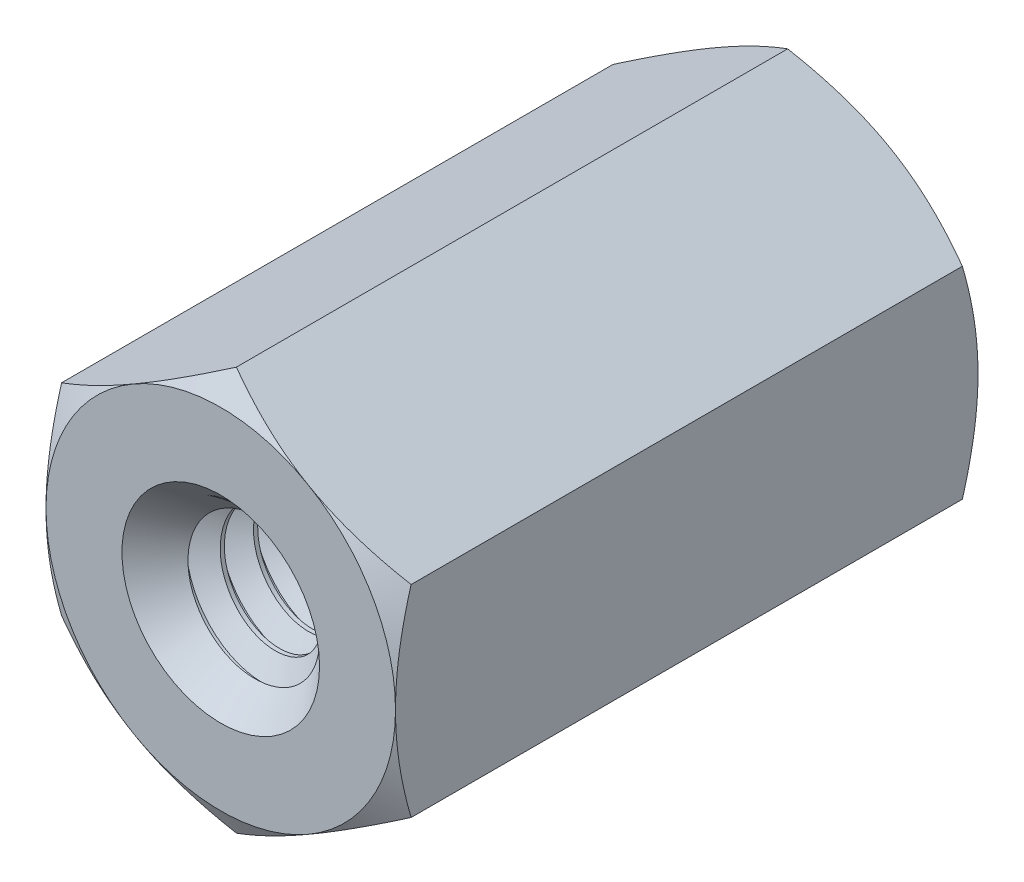
from build123d import *

# Parameters (mm, degrees)
EXTRUDE1_DEPTH     = 7.9375
SKETCH2_OUTSIDE_W  = 42.626
SKETCH2_OUTSIDE_H  = 43.364
SKETCH2_OUTSIDE_R  = 2.38125
CUT_EXTRUDE1_DEPTH = 9.73125
CUT_EXTRUDE1_DRAFT = -60
SKETCH3_OUTSIDE_W  = 42.626
SKETCH3_OUTSIDE_H  = 43.364
SKETCH3_OUTSIDE_R  = 2.38125
CUT_EXTRUDE2_DEPTH = 9.73125
CUT_EXTRUDE2_DRAFT = -60
SKETCH4_R          = 1.0922
CUT_EXTRUDE3_DEPTH = 9.73125
SKETCH12_R         = 1.0922
SKETCH12_R_2       = 0.797596715
EXTRUDE2_DEPTH     = 7.9375
CUT_SWEEP1_PITCH   = 0.453571429


with BuildPart() as part:
    # Sketch1 → Extrude1 (new body)
    with BuildSketch(Plane.XY):
        Polygon((0, 2.749630657), (-2.38125, 1.374815329), (-2.38125, -1.374815329), (0, -2.749630657), (2.38125, -1.374815329), (2.38125, 1.374815329), align=None)
    extrude(amount=-EXTRUDE1_DEPTH)


with BuildPart() as cut_extrude1_tool:
    # Sketch2 outside → Cut-Extrude1 (with draft: the straight prism first)
    with BuildSketch(Plane.XY):
        Rectangle(SKETCH2_OUTSIDE_W, SKETCH2_OUTSIDE_H)
        Circle(SKETCH2_OUTSIDE_R, mode=Mode.SUBTRACT)
    extrude(amount=-CUT_EXTRUDE1_DEPTH)
    # Cut-Extrude1: the draft: its side faces are tilted about the plane it starts from
    cut_extrude1_sides = [cut_extrude1_tool.faces().sort_by_distance(p)[0] for p in [
        (0, -21.682, -4.865625),
        (21.313, 0, -4.865625),
        (0, 21.682, -4.865625),
        (-21.313, 0, -4.865625),
        (-2.38125, 0, -4.865625),
    ]]
    draft(cut_extrude1_sides, Plane.XY, CUT_EXTRUDE1_DRAFT)


with BuildPart() as part_1:
    add(part.part)

    # Cut-Extrude1: cut by cut_extrude1_tool
    add(cut_extrude1_tool.part, mode=Mode.SUBTRACT)


with BuildPart() as cut_extrude2_tool:
    # Sketch3 outside → Cut-Extrude2 (with draft: the straight prism first)
    with BuildSketch(Plane(origin=(0, 0, -7.9375), x_dir=(-1, 0, 0), z_dir=(0, 0, -1))):
        Rectangle(SKETCH3_OUTSIDE_W, SKETCH3_OUTSIDE_H)
        Circle(SKETCH3_OUTSIDE_R, mode=Mode.SUBTRACT)
    extrude(amount=-CUT_EXTRUDE2_DEPTH)
    # Cut-Extrude2: the draft: its side faces are tilted about the plane it starts from
    cut_extrude2_sides = [cut_extrude2_tool.faces().sort_by_distance(p)[0] for p in [
        (0, -21.682, -3.071875),
        (-21.313, 0, -3.071875),
        (0, 21.682, -3.071875),
        (21.313, 0, -3.071875),
        (2.38125, 0, -3.071875),
    ]]
    draft(cut_extrude2_sides, Plane(origin=(0, 0, -7.9375), x_dir=(-1, 0, 0), z_dir=(0, 0, -1)), CUT_EXTRUDE2_DRAFT)


with BuildPart() as part_2:
    add(part_1.part)

    # Cut-Extrude2: cut by cut_extrude2_tool
    add(cut_extrude2_tool.part, mode=Mode.SUBTRACT)

    # Sketch4 → Cut-Extrude3 (cut, through all)
    with BuildSketch(Plane.XY):
        Circle(SKETCH4_R)
    extrude(amount=-CUT_EXTRUDE3_DEPTH, mode=Mode.SUBTRACT)

    # Sketch12 → Extrude2 (add)
    with BuildSketch(Plane.XY):
        Circle(SKETCH12_R)
        Circle(SKETCH12_R_2, mode=Mode.SUBTRACT)
    extrude(amount=-EXTRUDE2_DEPTH)

    # Cut-Sweep1: the profile of Sketch9 profile screwed along a right-hand helix of 18.5 turns, 6 arcs to a turn; built about Z, then put on its axis
    cut_sweep1_z = Axis((0, 0, 0), (0, 0, 1))
    cut_sweep1_corners = [(1.0922, 0, -0.226785714), (1.0922, 0, -0.170089286), (0.797296715, 0, 0.000173205), (0.797296715, 0, -0.397048205)]
    with BuildLine(mode=Mode.PRIVATE) as cut_sweep1_profile:
        Line(cut_sweep1_corners[0], cut_sweep1_corners[1])
        Line(cut_sweep1_corners[1], cut_sweep1_corners[2])
        Line(cut_sweep1_corners[2], cut_sweep1_corners[3])
        Line(cut_sweep1_corners[3], cut_sweep1_corners[0])
    cut_sweep1_cap = Face(cut_sweep1_profile.wire())
    cut_sweep1_turn_angles = [0, 30, 60, 90, 120, 150, 180, 210, 240, 270, 300, 330, 360]
    cut_sweep1_turn_weights = [1, 0.8660254037844387, 1, 0.8660254037844387, 1, 0.8660254037844387, 1, 0.8660254037844387, 1, 0.8660254037844387, 1, 0.8660254037844387, 1]
    cut_sweep1_turn_rails = [Edge.make_bspline([Vector(p[0], p[1], 0).rotate(cut_sweep1_z, cut_sweep1_turn_angles[k]) / cut_sweep1_turn_weights[k] + Vector(0, 0, p[2] + CUT_SWEEP1_PITCH * cut_sweep1_turn_angles[k] / 360) for k in range(13)], [0, 0, 0, 1, 1, 2, 2, 3, 3, 4, 4, 5, 5, 6, 6, 6], 2, cut_sweep1_turn_weights) for p in cut_sweep1_corners]
    cut_sweep1_turn_sides = [Face.make_surface_from_curves(cut_sweep1_turn_rails[p[0]], cut_sweep1_turn_rails[p[1]]) for p in [(0, 1), (1, 2), (2, 3), (3, 0)]]
    cut_sweep1_last_angles = [6480, 6510, 6540, 6570, 6600, 6630, 6660]
    cut_sweep1_last_weights = [1, 0.8660254037844387, 1, 0.8660254037844387, 1, 0.866025403784403, 1]
    cut_sweep1_last_rails = [Edge.make_bspline([Vector(p[0], p[1], 0).rotate(cut_sweep1_z, cut_sweep1_last_angles[k]) / cut_sweep1_last_weights[k] + Vector(0, 0, p[2] + CUT_SWEEP1_PITCH * cut_sweep1_last_angles[k] / 360) for k in range(7)], [0, 0, 0, 1, 1, 2, 2, 3, 3, 3], 2, cut_sweep1_last_weights) for p in cut_sweep1_corners]
    cut_sweep1_last_sides = [Face.make_surface_from_curves(cut_sweep1_last_rails[p[0]], cut_sweep1_last_rails[p[1]]) for p in [(0, 1), (1, 2), (2, 3), (3, 0)]]
    cut_sweep1 = Plane(origin=(0, 0, 0), x_dir=(0, 1, 0), z_dir=(0, 0, -1)) * Solid(Shell([*[p.moved(Location((0, 0, CUT_SWEEP1_PITCH * i))) for i in range(18) for p in cut_sweep1_turn_sides], *cut_sweep1_last_sides, cut_sweep1_cap, cut_sweep1_cap.rotate(cut_sweep1_z, 6660).moved(Location((0, 0, CUT_SWEEP1_PITCH * 6660 / 360)))]))
    add(cut_sweep1, mode=Mode.SUBTRACT)

    # Cut-Extrude6 cone 1 section (through the dimple's axis) → Cut-Extrude6 (revolve, cut)
    with BuildSketch(Plane(origin=(0, 0, 0), x_dir=(0, -1, 0), z_dir=(1, 0, 0))):
        Polygon((0, 0), (1.3462, 0), (0, 1.3462), align=None)
    revolve(axis=Axis((0, 0, 0), (0, 0, -1)), mode=Mode.SUBTRACT)

    # Cut-Extrude7 cone 1 section (through the dimple's axis) → Cut-Extrude7 (revolve, cut)
    with BuildSketch(Plane(origin=(0, 0, -7.9375), x_dir=(0, 1, 0), z_dir=(1, 0, 0))):
        Polygon((0, 0), (1.3462, 0), (0, 1.3462), align=None)
    revolve(axis=Axis((0, 0, -7.9375), (0, 0, 1)), mode=Mode.SUBTRACT)


solid = part_2.part
